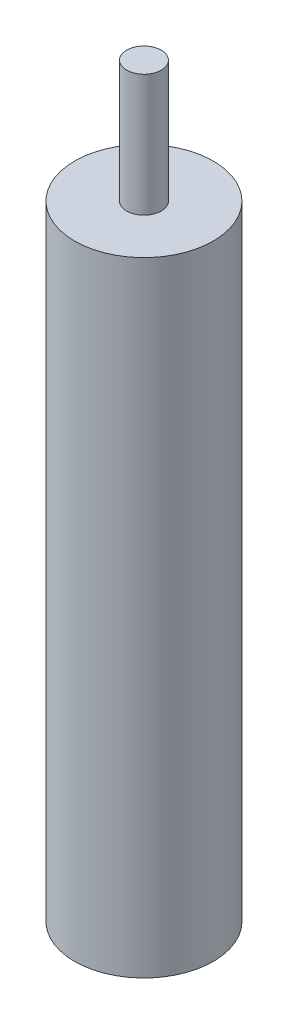
from build123d import *

# Parameters (mm, degrees)
SKETCH1_R           = 12.7
BOSS_EXTRUDE1_DEPTH = 114.3
SKETCH2_R           = 3.175
BOSS_EXTRUDE2_DEPTH = 22.352


with BuildPart() as part:
    # Sketch1 → Boss-Extrude1 (new body)
    with BuildSketch(Plane(origin=(0, 0, 0), x_dir=(1, 0, 0), z_dir=(0, 1, 0))):
        Circle(SKETCH1_R)
    extrude(amount=BOSS_EXTRUDE1_DEPTH)

    # Sketch2 → Boss-Extrude2 (add)
    with BuildSketch(Plane(origin=(0, 114.3, 0), x_dir=(1, 0, 0), z_dir=(0, 1, 0))):
        Circle(SKETCH2_R)
    extrude(amount=BOSS_EXTRUDE2_DEPTH)


solid = part.part
